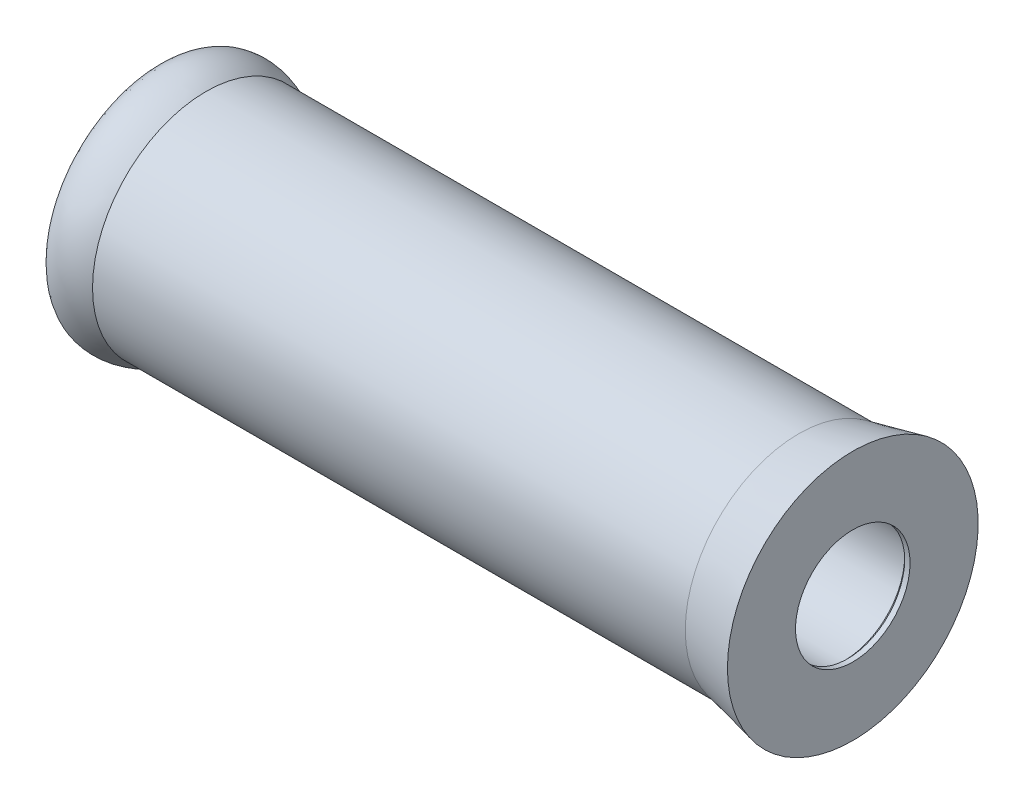
from build123d import *

# Parameters (mm, degrees)
SKETCH1_R           = 13.5
SKETCH1_R_2         = 11.2
BOSS_EXTRUDE1_DEPTH = 60
CIRPATTERN1_COUNT   = 8
LPATTERN1_COUNT     = 3
LPATTERN1_PITCH     = 20
FILLET1_R           = 3
BOSS_EXTRUDE3_START = -1
SKETCH4_R           = 11.2
SKETCH4_R_2         = 10.6
BOSS_EXTRUDE3_DEPTH = 1
CHAMFER1_SIZE       = 0.6


# Some blends are built 0.0001 mm under size
with BuildPart() as part:
    # Sketch1 → Boss-Extrude1 (new body)
    with BuildSketch(Plane(origin=(0, 0, 0), x_dir=(0, 0, -1), z_dir=(1, 0, 0))):
        Circle(SKETCH1_R)
        Circle(SKETCH1_R_2, mode=Mode.SUBTRACT)
    extrude(amount=BOSS_EXTRUDE1_DEPTH)

    # Sketch2 → Cut-Revolve1 (revolve, cut)
    with BuildSketch(Plane.XY):
        with BuildLine():
            Line((8, 12.6), (8, 9.6))
            Line((8, 9.6), (11, 9.6))
            ThreePointArc((11, 9.6), (10.121320344, 11.721320344), (8, 12.6))
        make_face()
    cut_revolve1 = revolve(axis=Axis((8, 12.6, 0), (0, -1, 0)), mode=Mode.SUBTRACT)

    # CirPattern1: Cut-Revolve1 ×8 about axis
    cirpattern1_axis = Axis((0, 0, 0), (1, 0, 0))
    for i in range(1, CIRPATTERN1_COUNT):
        add(cut_revolve1.rotate(cirpattern1_axis, i * 360 / CIRPATTERN1_COUNT), mode=Mode.SUBTRACT)

    # LPattern1: Cut-Revolve1 ×3
    with Locations(*[(i * LPATTERN1_PITCH, 0, 0) for i in range(1, LPATTERN1_COUNT)]):
        add(cut_revolve1, mode=Mode.SUBTRACT)

    # LPattern1 copy 1 sketch → LPattern1 copy 1 (revolve, cut)
    with BuildSketch(Plane(origin=(20, 0, 0), x_dir=(1, 0, 0), z_dir=(0, -0.7071067811865475, 0.7071067811865476))):
        with BuildLine():
            Line((8, 12.6), (8, 9.6))
            Line((8, 9.6), (11, 9.6))
            ThreePointArc((11, 9.6), (10.121320344, 11.721320344), (8, 12.6))
        make_face()
    revolve(axis=Axis((28, 8.909545443, 8.909545443), (0, -0.7071067811865476, -0.7071067811865475)), mode=Mode.SUBTRACT)

    # LPattern1 copy 2 sketch → LPattern1 copy 2 (revolve, cut)
    with BuildSketch(Plane(origin=(40, 0, 0), x_dir=(1, 0, 0), z_dir=(0, -0.7071067811865475, 0.7071067811865476))):
        with BuildLine():
            Line((8, 12.6), (8, 9.6))
            Line((8, 9.6), (11, 9.6))
            ThreePointArc((11, 9.6), (10.121320344, 11.721320344), (8, 12.6))
        make_face()
    revolve(axis=Axis((48, 8.909545443, 8.909545443), (0, -0.7071067811865476, -0.7071067811865475)), mode=Mode.SUBTRACT)

    # LPattern1 copy 3 sketch → LPattern1 copy 3 (revolve, cut)
    with BuildSketch(Plane(origin=(20, 0, 0), x_dir=(1, 0, 0), z_dir=(0, -1, 0))):
        with BuildLine():
            Line((8, 12.6), (8, 9.6))
            Line((8, 9.6), (11, 9.6))
            ThreePointArc((11, 9.6), (10.121320344, 11.721320344), (8, 12.6))
        make_face()
    revolve(axis=Axis((28, 0, 12.6), (0, 0, -1)), mode=Mode.SUBTRACT)

    # LPattern1 copy 4 sketch → LPattern1 copy 4 (revolve, cut)
    with BuildSketch(Plane(origin=(40, 0, 0), x_dir=(1, 0, 0), z_dir=(0, -1, 0))):
        with BuildLine():
            Line((8, 12.6), (8, 9.6))
            Line((8, 9.6), (11, 9.6))
            ThreePointArc((11, 9.6), (10.121320344, 11.721320344), (8, 12.6))
        make_face()
    revolve(axis=Axis((48, 0, 12.6), (0, 0, -1)), mode=Mode.SUBTRACT)

    # LPattern1 copy 5 sketch → LPattern1 copy 5 (revolve, cut)
    with BuildSketch(Plane(origin=(20, 0, 0), x_dir=(1, 0, 0), z_dir=(0, -0.7071067811865476, -0.7071067811865475))):
        with BuildLine():
            Line((8, 12.6), (8, 9.6))
            Line((8, 9.6), (11, 9.6))
            ThreePointArc((11, 9.6), (10.121320344, 11.721320344), (8, 12.6))
        make_face()
    revolve(axis=Axis((28, -8.909545443, 8.909545443), (0, 0.7071067811865475, -0.7071067811865476)), mode=Mode.SUBTRACT)

    # LPattern1 copy 6 sketch → LPattern1 copy 6 (revolve, cut)
    with BuildSketch(Plane(origin=(40, 0, 0), x_dir=(1, 0, 0), z_dir=(0, -0.7071067811865476, -0.7071067811865475))):
        with BuildLine():
            Line((8, 12.6), (8, 9.6))
            Line((8, 9.6), (11, 9.6))
            ThreePointArc((11, 9.6), (10.121320344, 11.721320344), (8, 12.6))
        make_face()
    revolve(axis=Axis((48, -8.909545443, 8.909545443), (0, 0.7071067811865475, -0.7071067811865476)), mode=Mode.SUBTRACT)

    # LPattern1 copy 7 sketch → LPattern1 copy 7 (revolve, cut)
    with BuildSketch(Plane(origin=(20, 0, 0), x_dir=(1, 0, 0), z_dir=(0, 0, -1))):
        with BuildLine():
            Line((8, 12.6), (8, 9.6))
            Line((8, 9.6), (11, 9.6))
            ThreePointArc((11, 9.6), (10.121320344, 11.721320344), (8, 12.6))
        make_face()
    revolve(axis=Axis((28, -12.6, 0), (0, 1, 0)), mode=Mode.SUBTRACT)

    # LPattern1 copy 8 sketch → LPattern1 copy 8 (revolve, cut)
    with BuildSketch(Plane(origin=(40, 0, 0), x_dir=(1, 0, 0), z_dir=(0, 0, -1))):
        with BuildLine():
            Line((8, 12.6), (8, 9.6))
            Line((8, 9.6), (11, 9.6))
            ThreePointArc((11, 9.6), (10.121320344, 11.721320344), (8, 12.6))
        make_face()
    revolve(axis=Axis((48, -12.6, 0), (0, 1, 0)), mode=Mode.SUBTRACT)

    # LPattern1 copy 9 sketch → LPattern1 copy 9 (revolve, cut)
    with BuildSketch(Plane(origin=(20, 0, 0), x_dir=(1, 0, 0), z_dir=(0, 0.7071067811865475, -0.7071067811865477))):
        with BuildLine():
            Line((8, 12.6), (8, 9.6))
            Line((8, 9.6), (11, 9.6))
            ThreePointArc((11, 9.6), (10.121320344, 11.721320344), (8, 12.6))
        make_face()
    revolve(axis=Axis((28, -8.909545443, -8.909545443), (0, 0.7071067811865477, 0.7071067811865475)), mode=Mode.SUBTRACT)

    # LPattern1 copy 10 sketch → LPattern1 copy 10 (revolve, cut)
    with BuildSketch(Plane(origin=(40, 0, 0), x_dir=(1, 0, 0), z_dir=(0, 0.7071067811865475, -0.7071067811865477))):
        with BuildLine():
            Line((8, 12.6), (8, 9.6))
            Line((8, 9.6), (11, 9.6))
            ThreePointArc((11, 9.6), (10.121320344, 11.721320344), (8, 12.6))
        make_face()
    revolve(axis=Axis((48, -8.909545443, -8.909545443), (0, 0.7071067811865477, 0.7071067811865475)), mode=Mode.SUBTRACT)

    # LPattern1 copy 11 sketch → LPattern1 copy 11 (revolve, cut)
    with BuildSketch(Plane(origin=(20, 0, 0), x_dir=(1, 0, 0), z_dir=(0, 1, 0))):
        with BuildLine():
            Line((8, 12.6), (8, 9.6))
            Line((8, 9.6), (11, 9.6))
            ThreePointArc((11, 9.6), (10.121320344, 11.721320344), (8, 12.6))
        make_face()
    revolve(axis=Axis((28, 0, -12.6), (0, 0, 1)), mode=Mode.SUBTRACT)

    # LPattern1 copy 12 sketch → LPattern1 copy 12 (revolve, cut)
    with BuildSketch(Plane(origin=(40, 0, 0), x_dir=(1, 0, 0), z_dir=(0, 1, 0))):
        with BuildLine():
            Line((8, 12.6), (8, 9.6))
            Line((8, 9.6), (11, 9.6))
            ThreePointArc((11, 9.6), (10.121320344, 11.721320344), (8, 12.6))
        make_face()
    revolve(axis=Axis((48, 0, -12.6), (0, 0, 1)), mode=Mode.SUBTRACT)

    # LPattern1 copy 13 sketch → LPattern1 copy 13 (revolve, cut)
    with BuildSketch(Plane(origin=(20, 0, 0), x_dir=(1, 0, 0), z_dir=(0, 0.7071067811865477, 0.7071067811865474))):
        with BuildLine():
            Line((8, 12.6), (8, 9.6))
            Line((8, 9.6), (11, 9.6))
            ThreePointArc((11, 9.6), (10.121320344, 11.721320344), (8, 12.6))
        make_face()
    revolve(axis=Axis((28, 8.909545443, -8.909545443), (0, -0.7071067811865474, 0.7071067811865477)), mode=Mode.SUBTRACT)

    # LPattern1 copy 14 sketch → LPattern1 copy 14 (revolve, cut)
    with BuildSketch(Plane(origin=(40, 0, 0), x_dir=(1, 0, 0), z_dir=(0, 0.7071067811865477, 0.7071067811865474))):
        with BuildLine():
            Line((8, 12.6), (8, 9.6))
            Line((8, 9.6), (11, 9.6))
            ThreePointArc((11, 9.6), (10.121320344, 11.721320344), (8, 12.6))
        make_face()
    revolve(axis=Axis((48, 8.909545443, -8.909545443), (0, -0.7071067811865474, 0.7071067811865477)), mode=Mode.SUBTRACT)

    # Fillet1
    # the kernel refuses this fillet: 3 mm, written as the material it takes off along each edge
    with BuildSketch(Plane(origin=(0, 0, 0), x_dir=(0, 0, -1), z_dir=(0, -1, 0))) as fillet1_piece_1:
        with BuildLine():
            CenterArc((14.2, 2.917190429), FILLET1_R, 180, 76.506601178)
            Line((11.2, 2.917190429), (11.14, 2.917190429))
            Line((11.14, 2.917190429), (11.14, 0))
            Line((11.14, 0), (11.2, -0.06))
            ThreePointArc((11.2, -0.06), (12.35, -0.06), (13.486, -0.058343809))
            Line((13.486, -0.058343809), (13.5, 0))
        make_face()
    revolve(axis=Axis((0, 0, 0), (1, 0, 0)), mode=Mode.SUBTRACT)

    # Sketch3 → Revolve1 (revolve)
    with BuildSketch(Plane.XY, mode=Mode.PRIVATE) as revolve1_sk:
        with BuildLine():
            Line((10.3, 21), (120, 21))
            Line((120, 21), (130, 23.2))
            Line((130, 23.2), (130, 11.2))
            Line((130, 11.2), (60, 11.2))
            Line((60, 11.2), (60, 13.5))
            Line((60, 13.5), (0, 13.5))
            add(Edge.make_bspline(
                [(0, 13.5), (0, 17.4), (0.724406264, 20.887336255), (4.53233955, 22.78567651), (7.701923789, 22.5), (10.3, 21)],
                knots=[0, 0, 0, 0, 0.520343336, 0.620343336, 1, 1, 1, 1], degree=3))
        make_face()
    revolve(revolve1_sk.sketch.rotate(Axis((0, 0, 0), (1, 0, 0)), 90), axis=Axis((0, 0, 0), (1, 0, 0)))

    # Sketch4 → Boss-Extrude3 (add)
    with BuildSketch(Plane(origin=(130, 0, 0), x_dir=(0, 0, -1), z_dir=(1, 0, 0)).offset(BOSS_EXTRUDE3_START)):
        with Locations(Location((0, 0, 0), (0, 0, 180))):
            Circle(SKETCH4_R)
        Circle(SKETCH4_R_2, mode=Mode.SUBTRACT)
    extrude(amount=BOSS_EXTRUDE3_DEPTH)

    # Chamfer1
    chamfer1_edges = [part.edges().sort_by_distance(p)[0] for p in [
        (129, 0, -11.2),
    ]]
    chamfer(chamfer1_edges, length=CHAMFER1_SIZE - 0.0001)  # a hair under: the kernel refuses the full size


solid = part.part
